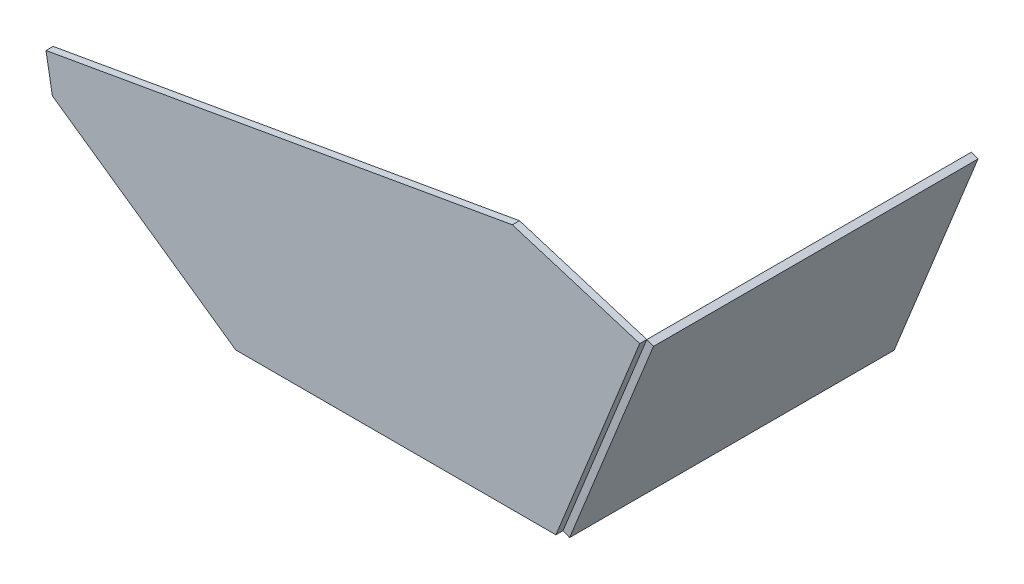
from build123d import *

# Parameters (mm, degrees)
BOSS_EXTRUDE1_DEPTH = 290
BOSS_EXTRUDE2_DEPTH = 6.35


with BuildPart() as part:
    # Sketch1 → Boss-Extrude1 (new body)
    with BuildSketch(Plane.XY):
        Polygon((137.5, 0), (143.387617476, -2.378751868), (218.30893616, 183.058019045), (212.421318683, 185.436770913), align=None)
    extrude(amount=BOSS_EXTRUDE1_DEPTH)


with BuildPart() as body_2:
    # Sketch2 → Boss-Extrude2 (new body)
    with BuildSketch(Plane.XY.offset(290)):
        Polygon((-318.093410334, 146.99687175), (98.624232146, 220.475435456), (212.421318683, 185.436770913), (137.5, 0), (-148.570887152, 0), (-312.40129601, 114.71528727), align=None)
    extrude(amount=BOSS_EXTRUDE2_DEPTH)


solid = Compound([part.part, body_2.part])
